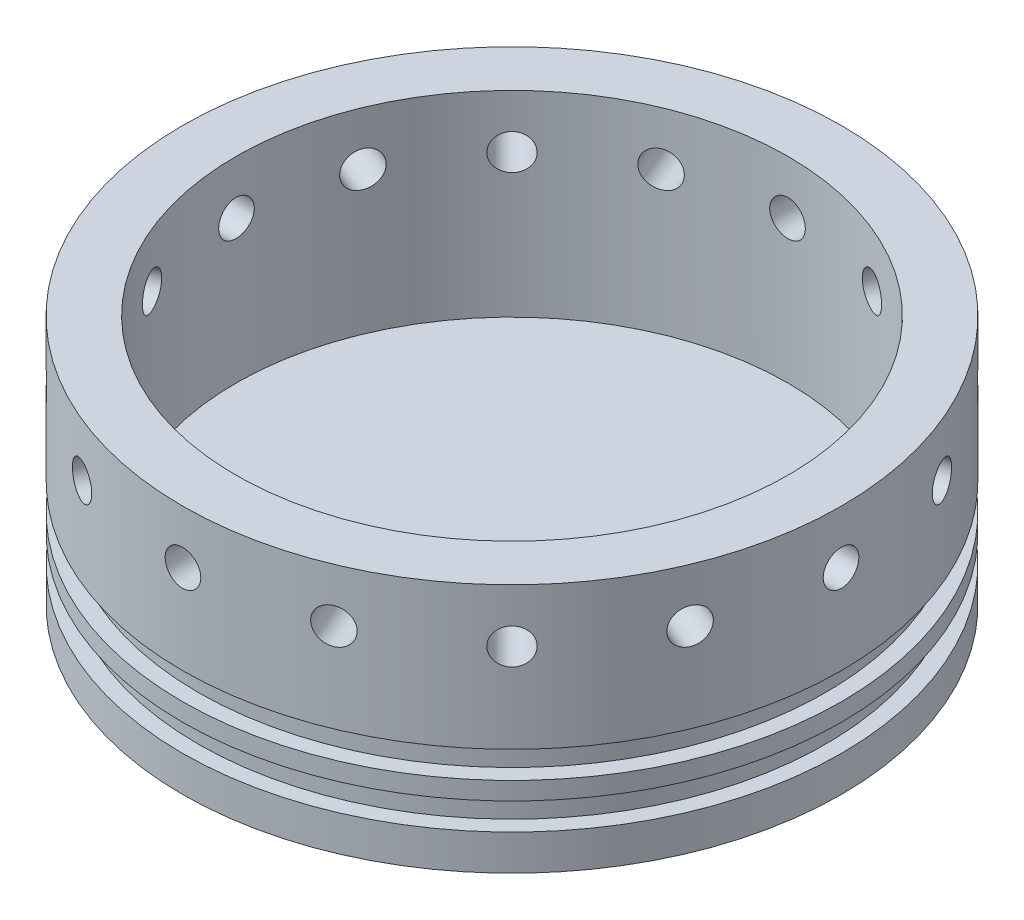
from build123d import *

# Parameters (mm, degrees)
FORWARDCLOSUREHOLES_D = 6.35
HOLEPATTERN_COUNT     = 16


with BuildPart() as part:
    # Sketch1 → Revolve1 (revolve)
    with BuildSketch(Plane.XY):
        Polygon((0, 6.35), (0, 0), (58.7375, 0), (58.7375, 9.525), (9.525, 9.525), (9.525, 44.5262), (0, 44.5262), (0, 19.1262), (2.8194, 19.1262), (2.8194, 14.3256), (0, 14.3256), (0, 11.1506), (2.8194, 11.1506), (2.8194, 6.35), align=None)
    revolve(axis=Axis((58.7375, 0, 0), (0, 1, 0)))

    # ForwardClosureHoles (through all)
    with Locations(Plane.XY.offset(58.7375)):
        with Locations((58.7375, 35.0012)):
            forwardclosureholes = Hole(FORWARDCLOSUREHOLES_D / 2)

    # HolePattern: ForwardClosureHoles ×16 about axis
    holepattern_axis = Axis((58.7375, 44.5262, 0), (0, -1, 0))
    for i in range(1, HOLEPATTERN_COUNT):
        add(forwardclosureholes.rotate(holepattern_axis, i * 360 / HOLEPATTERN_COUNT), mode=Mode.SUBTRACT)


solid = part.part
